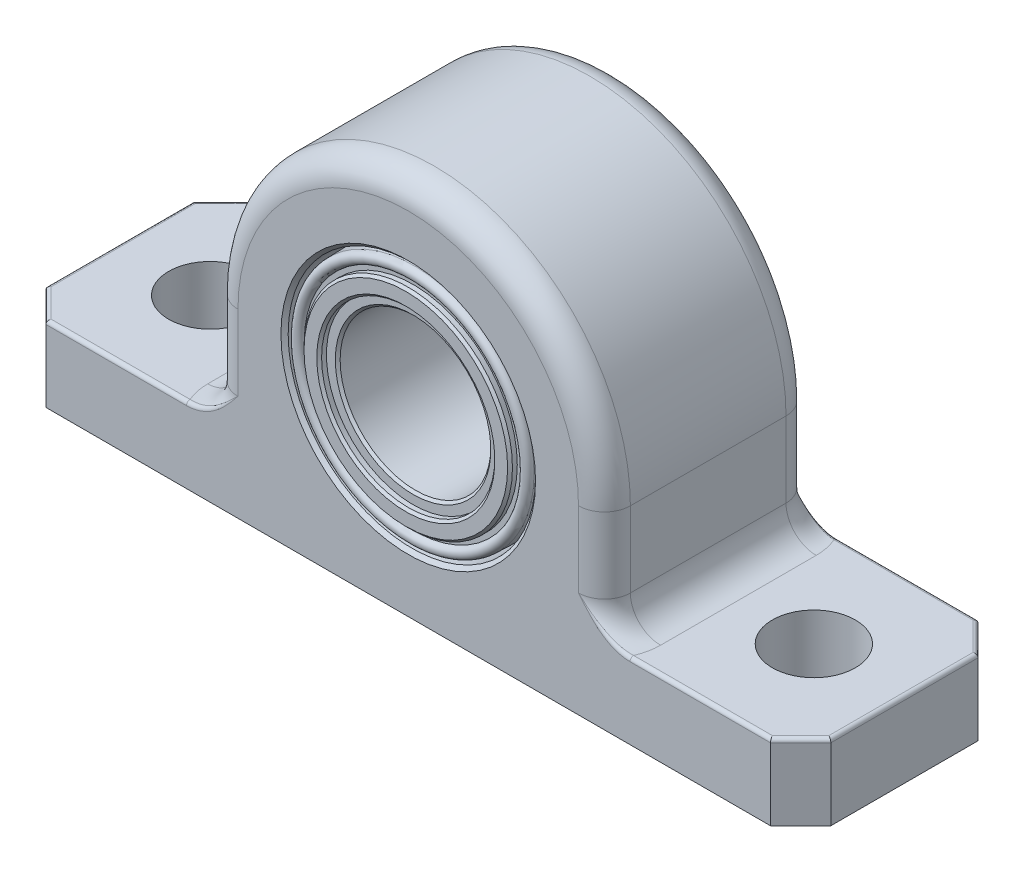
from build123d import *

# Parameters (mm, degrees)
BOSS_EXTRUDE1_DEPTH      = 10.914063
BOSS_EXTRUDE1_DEPTH_BACK = 10.914062
SKETCH3_R                = 13.00988
SKETCH4_R                = 4.365625
CUT_EXTRUDE1_DEPTH       = 59.290994608
CHAMFER1_SIZE            = 3.175
FILLET1_R                = 2.728515625
FILLET2_R                = 3.175
CHAMFER2_SIZE            = 0.381
FILLET3_R                = 0.381
CHAMFER3_SIZE            = 0.254


with BuildPart() as part:
    # Sketch3 → Boss-Extrude1 (new, two sides: drawn at the far end of the back side and taken through both)
    with BuildSketch(Plane.XY.offset(-BOSS_EXTRUDE1_DEPTH_BACK)):
        with BuildLine():
            Line((-41.275, 0), (-41.275, 7.9375))
            Line((-41.275, 7.9375), (-20.6375, 7.9375))
            Line((-20.6375, 7.9375), (-20.6375, 19.05))
            ThreePointArc((-20.6375, 19.05), (0, 39.6875), (20.6375, 19.05))
            Line((20.6375, 19.05), (20.6375, 7.9375))
            Line((20.6375, 7.9375), (41.275, 7.9375))
            Line((41.275, 7.9375), (41.275, 0))
            Line((41.275, 0), (-41.275, 0))
        make_face()
        with Locations((0, 19.05)):
            Circle(SKETCH3_R, mode=Mode.SUBTRACT)
    extrude(amount=BOSS_EXTRUDE1_DEPTH + BOSS_EXTRUDE1_DEPTH_BACK)

    # Sketch4 → Cut-Extrude1 (cut, through all)
    with BuildSketch(Plane(origin=(0, 0, 0), x_dir=(1, 0, 0), z_dir=(0, 1, 0))):
        with Locations(Location((-31.75, 0, 0), (0, 0, 90))):
            Circle(SKETCH4_R)
        with Locations(Location((31.75, 0, 0), (0, 0, 90))):
            Circle(SKETCH4_R)
    extrude(amount=CUT_EXTRUDE1_DEPTH, mode=Mode.SUBTRACT)

    # Chamfer1
    chamfer1_edges = [part.edges().sort_by_distance(p)[0] for p in [
        (41.275, 3.96875, 10.914063),
        (-41.275, 3.96875, -10.914062),
        (-41.275, 3.96875, 10.914063),
        (41.275, 3.96875, -10.914062),
    ]]
    chamfer(chamfer1_edges, length=CHAMFER1_SIZE)

    # Fillet1
    fillet1_edges = [part.edges().sort_by_distance(p)[0] for p in [
        (20.6375, 13.49375, -10.914062),
        (0, 39.6875, -10.914062),
        (-20.6375, 13.49375, -10.914062),
        (20.6375, 13.49375, 10.914063),
        (0, 39.6875, 10.914063),
        (-20.6375, 13.49375, 10.914063),
    ]]
    fillet(fillet1_edges, radius=FILLET1_R)

    # Fillet2
    # the kernel refuses this fillet: 3.175 mm, written as the material it adds along each edge
    with BuildSketch(Plane(origin=(-20.6375, 7.9375, 8.185547375), x_dir=(-1, 0, 0), z_dir=(0, 0, -1))) as fillet2_piece_1:
        with BuildLine():
            CenterArc((FILLET2_R, FILLET2_R), FILLET2_R, 180, 90)
            Line((0, FILLET2_R), (0, 0))
            Line((0, 0), (FILLET2_R, 0))
        make_face()
    extrude(amount=16.37109375)
    with BuildSketch(Plane(origin=(20.6375, 7.9375, 8.185547375), x_dir=(1, 0, 0), z_dir=(0, 0, -1))) as fillet2_piece_2:
        with BuildLine():
            CenterArc((FILLET2_R, -FILLET2_R), FILLET2_R, 90, 90)
            Line((0, -FILLET2_R), (0, 0))
            Line((0, 0), (FILLET2_R, 0))
        make_face()
    extrude(amount=16.37109375)
    with BuildSketch(Plane(origin=(-17.908984375, 7.9375, -8.185546375), x_dir=(0.22927535316558662, 0, 0.9733616041486306), z_dir=(-0.9733616041486306, 0, 0.22927535316558662))) as fillet2_piece_3_section:
        with BuildLine():
            CenterArc((2.728515625 + FILLET2_R, FILLET2_R), FILLET2_R, 180, 90)
            Line((2.728515625, FILLET2_R), (2.728515625, 0))
            Line((2.728515625, 0), (2.728515625 + FILLET2_R, 0))
        make_face()
    fillet2_piece_3 = revolve(axis=Axis((-17.908984375, 7.9375, -8.185546375), (0, 1, 0)), revolution_arc=256.745587476, mode=Mode.PRIVATE)
    fillet2_piece_3 = split(fillet2_piece_3, bisect_by=Plane(origin=(-19.962848446, 8.957951509, -10.914062), z_dir=(0, 0, 1)), keep=Keep.TOP, mode=Mode.PRIVATE)
    add(fillet2_piece_3)
    with BuildSketch(Plane(origin=(-17.908984375, 7.9375, 8.185547375), x_dir=(0.22927535316558662, 0, -0.9733616041486306), z_dir=(-0.9733616041486306, 0, -0.22927535316558662))) as fillet2_piece_4_section:
        with BuildLine():
            CenterArc((2.728515625 + FILLET2_R, -FILLET2_R), FILLET2_R, 90, 90)
            Line((2.728515625, -FILLET2_R), (2.728515625, 0))
            Line((2.728515625, 0), (2.728515625 + FILLET2_R, 0))
        make_face()
    fillet2_piece_4 = revolve(axis=Axis((-17.908984375, 7.9375, 8.185547375), (0, -1, 0)), revolution_arc=256.745587476, mode=Mode.PRIVATE)
    fillet2_piece_4 = split(fillet2_piece_4, bisect_by=Plane(origin=(-19.962848446, 8.957951509, 10.914063), z_dir=(0, 0, -1)), keep=Keep.TOP, mode=Mode.PRIVATE)
    add(fillet2_piece_4)
    with BuildSketch(Plane(origin=(17.908984375, 7.9375, -8.185546375), x_dir=(-0.22927535316558662, 0, 0.9733616041486306), z_dir=(0.9733616041486306, 0, 0.22927535316558662))) as fillet2_piece_5_section:
        with BuildLine():
            CenterArc((2.728515625 + FILLET2_R, -FILLET2_R), FILLET2_R, 90, 90)
            Line((2.728515625, -FILLET2_R), (2.728515625, 0))
            Line((2.728515625, 0), (2.728515625 + FILLET2_R, 0))
        make_face()
    fillet2_piece_5 = revolve(axis=Axis((17.908984375, 7.9375, -8.185546375), (0, -1, 0)), revolution_arc=256.745587476, mode=Mode.PRIVATE)
    fillet2_piece_5 = split(fillet2_piece_5, bisect_by=Plane(origin=(19.962848343, 8.957951859, -10.914062), z_dir=(0, 0, 1)), keep=Keep.TOP, mode=Mode.PRIVATE)
    add(fillet2_piece_5)
    with BuildSketch(Plane(origin=(17.908984375, 7.9375, 8.185547375), x_dir=(-0.22927535316558662, 0, -0.9733616041486306), z_dir=(0.9733616041486306, 0, -0.22927535316558662))) as fillet2_piece_6_section:
        with BuildLine():
            CenterArc((2.728515625 + FILLET2_R, FILLET2_R), FILLET2_R, 180, 90)
            Line((2.728515625, FILLET2_R), (2.728515625, 0))
            Line((2.728515625, 0), (2.728515625 + FILLET2_R, 0))
        make_face()
    fillet2_piece_6 = revolve(axis=Axis((17.908984375, 7.9375, 8.185547375), (0, 1, 0)), revolution_arc=256.745587476, mode=Mode.PRIVATE)
    fillet2_piece_6 = split(fillet2_piece_6, bisect_by=Plane(origin=(19.962848343, 8.957951859, 10.914063), z_dir=(0, 0, -1)), keep=Keep.TOP, mode=Mode.PRIVATE)
    add(fillet2_piece_6)

    # Chamfer2
    chamfer2_edges = [part.edges().sort_by_distance(p)[0] for p in [
        (-13.00988, 19.05, -10.914062),
        (-13.00988, 19.05, 10.914063),
    ]]
    chamfer(chamfer2_edges, length=CHAMFER2_SIZE)

    # Fillet3
    fillet3_edges = [part.edges().sort_by_distance(p)[0] for p in [
        (-30.622062589, 7.9375, -10.914062),
        (-30.622062589, 7.9375, 10.914063),
        (-20.20983022, 8.960461716, -10.914062),
        (-20.20983022, 8.960461716, 10.914063),
        (20.20983022, 8.960461716, -10.914062),
        (20.20983022, 8.960461716, 10.914063),
        (-41.275, 7.9375, 5e-07),
        (30.622062589, 7.9375, -10.914062),
        (-39.6875, 7.9375, 9.326563),
        (-39.6875, 7.9375, -9.326562),
        (30.622062589, 7.9375, 10.914063),
        (41.275, 7.9375, 5e-07),
        (39.6875, 7.9375, -9.326562),
        (39.6875, 7.9375, 9.326563),
    ]]
    fillet(fillet3_edges, radius=FILLET3_R)


with BuildPart() as body_2:
    # Sketch6 → Revolve1 (revolve)
    with BuildSketch(Plane(origin=(0, 0, 0), x_dir=(0, 0, -1), z_dir=(1, 0, 0)), mode=Mode.PRIVATE) as revolve1_sk:
        with BuildLine():
            Line((0, 32.05988), (10.9140625, 32.05988))
            Line((10.9140625, 32.05988), (10.9140625, 30.497216525))
            Line((10.9140625, 30.497216525), (7.1040625, 30.497216525))
            Line((7.1040625, 30.497216525), (7.1040625, 30.01264))
            Line((7.1040625, 30.01264), (9.6440625, 30.01264))
            Line((9.6440625, 30.01264), (9.6440625, 28.16352))
            Line((9.6440625, 28.16352), (8.8820625, 28.16352))
            Line((8.8820625, 28.16352), (8.8820625, 26.9748))
            Line((8.8820625, 26.9748), (-10.4060625, 26.9748))
            Line((-10.4060625, 26.9748), (-10.4060625, 28.16352))
            Line((-10.4060625, 28.16352), (-11.1680625, 28.16352))
            Line((-11.1680625, 28.16352), (-11.1680625, 30.01264))
            Line((-11.1680625, 30.01264), (-10.4060625, 30.01264))
            Line((-10.4060625, 30.01264), (-10.4060625, 30.497216525))
            ThreePointArc((-10.4060625, 30.497216525), (-10.91285809, 31.132604694), (-10.330112422, 31.699144525))
            Line((-10.330112422, 31.699144525), (0, 32.05988))
        make_face()
    revolve(revolve1_sk.sketch.rotate(Axis((0, 19.05, 10.9140625), (0, 0, -1)), 90), axis=Axis((0, 19.05, 10.9140625), (0, 0, -1)))

    # Chamfer3
    chamfer3_edges = [body_2.edges().sort_by_distance(p)[0] for p in [
        (-10.96264, 19.05, -9.6440625),
        (-9.11352, 19.05, -9.6440625),
        (-7.9248, 19.05, -8.8820625),
        (-7.9248, 19.05, 10.4060625),
        (-9.11352, 19.05, 11.1680625),
        (-10.96264, 19.05, 11.1680625),
    ]]
    chamfer(chamfer3_edges, length=CHAMFER3_SIZE)


solid = Compound([part.part, body_2.part])
